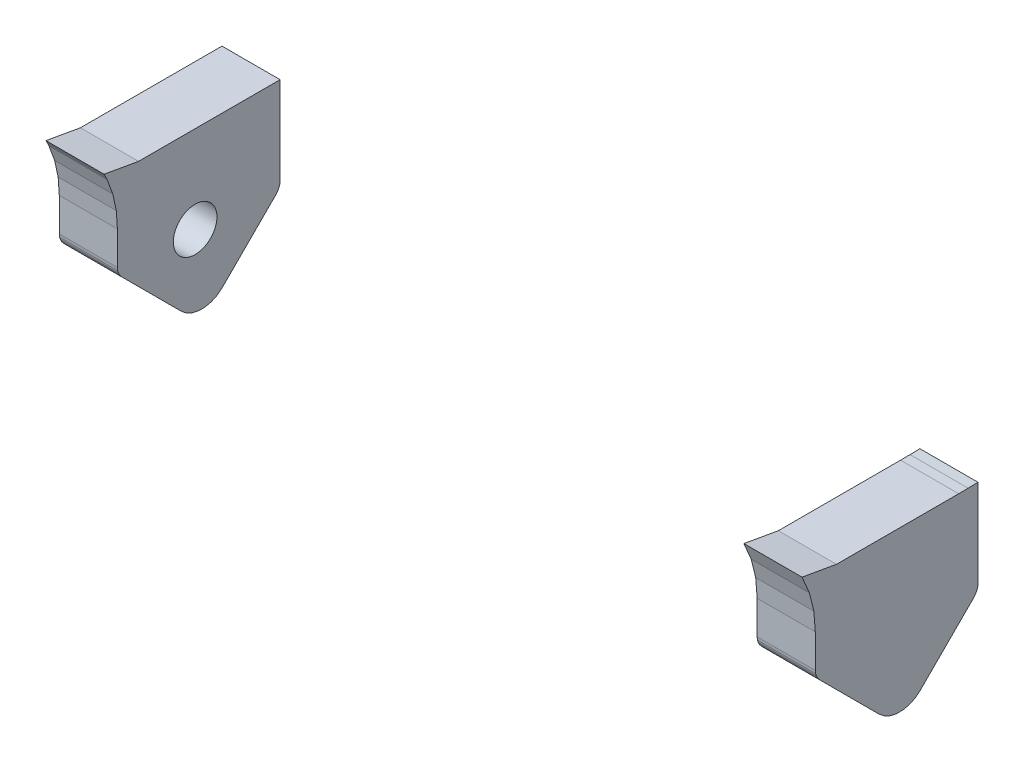
from build123d import *

# Parameters (mm, degrees)
EXTRUDE_1_DEPTH     = 2
SKETCH_7_R          = 0.750002586
CUT_EXTRUDE_1_DEPTH = 1.5
EXTRUDE_2_DEPTH     = 2
SKETCH_10_R         = 0.750007818
CUT_EXTRUDE_6_DEPTH = 1.5


# Read off the part's stored shape, not the designer's step: Поверхность-Импортированный1
with BuildPart() as part:
    # Эскиз1 → Бобышка-Вытянуть1 (new body)
    with BuildSketch(Plane.ZY.offset(-23.000001907)):
        Polygon((2.404000144, 8.042947389), (2.413999988, 7.94494804), (2.441999968, 7.85094779), (2.490000101, 7.764948066), (2.552000107, 7.688947488), (4.392000381, 5.848947447), (4.566000309, 5.708947778), (4.767999984, 5.610947497), (4.986000713, 5.562947597), (5.210000556, 5.562947597), (5.428000353, 5.610947497), (5.630000494, 5.708947778), (5.806000438, 5.848947447), (7.852001116, 7.894948125), (7.914000191, 7.970947772), (7.960000075, 8.056947961), (7.990000769, 8.15094728), (8.00000038, 8.248948492), (8.00000038, 9.39694792), (8.050000295, 10.038947687), (8.204000071, 10.662948713), (8.456000127, 11.254947633), (7.270000409, 11.044948362), (3.068000078, 11.044948362), (2.742000157, 11.046947911), (2.404000144, 11.054947972), align=None)
    extrude(amount=-EXTRUDE_1_DEPTH)

    # Эскиз7 → Вырез-Вытянуть1 (cut)
    with BuildSketch(Plane.ZY.offset(-23.000001907)):
        with Locations((5.322727094, 8.038945713)):
            Circle(SKETCH_7_R)
    extrude(amount=-CUT_EXTRUDE_1_DEPTH, mode=Mode.SUBTRACT)


with BuildPart() as body_2:
    # Эскиз8 → Бобышка-Вытянуть2 (new body)
    with BuildSketch(Plane(origin=(0.998000149, 0, 0), x_dir=(0, 0, -1), z_dir=(1, 0, 0))):
        Polygon((-2.404000144, 11.044948362), (-2.404000144, 8.042947389), (-2.413999988, 7.94494804), (-2.441999968, 7.85094779), (-2.490000101, 7.764948066), (-2.552000107, 7.688947488), (-4.392000381, 5.848947447), (-4.566000309, 5.708947778), (-4.767999984, 5.610947497), (-4.986000713, 5.562947597), (-5.210000556, 5.562947597), (-5.428000353, 5.610947497), (-5.630000494, 5.708947778), (-5.806000438, 5.848947447), (-7.852001116, 7.894948125), (-7.914000191, 7.970947772), (-7.960000075, 8.056947961), (-7.990000769, 8.15094728), (-8.00000038, 8.248948492), (-8.00000038, 9.39694792), (-8.038000204, 9.960947558), (-8.158001117, 10.514947586), (-8.353999816, 11.044948362), (-8.38800054, 11.116947979), (-8.422001265, 11.186948046), (-8.456000127, 11.254947633), (-7.272000425, 11.046947911), align=None)
    extrude(amount=-EXTRUDE_2_DEPTH)

    # Эскиз10 → Вырез-Вытянуть6 (cut)
    with BuildSketch(Plane(origin=(0.998000149, 0, 0), x_dir=(0, 0, -1), z_dir=(1, 0, 0))):
        with Locations((-5.327250078, 8.046939634)):
            Circle(SKETCH_10_R)
    extrude(amount=-CUT_EXTRUDE_6_DEPTH, mode=Mode.SUBTRACT)


solid = Compound([part.part, body_2.part])
